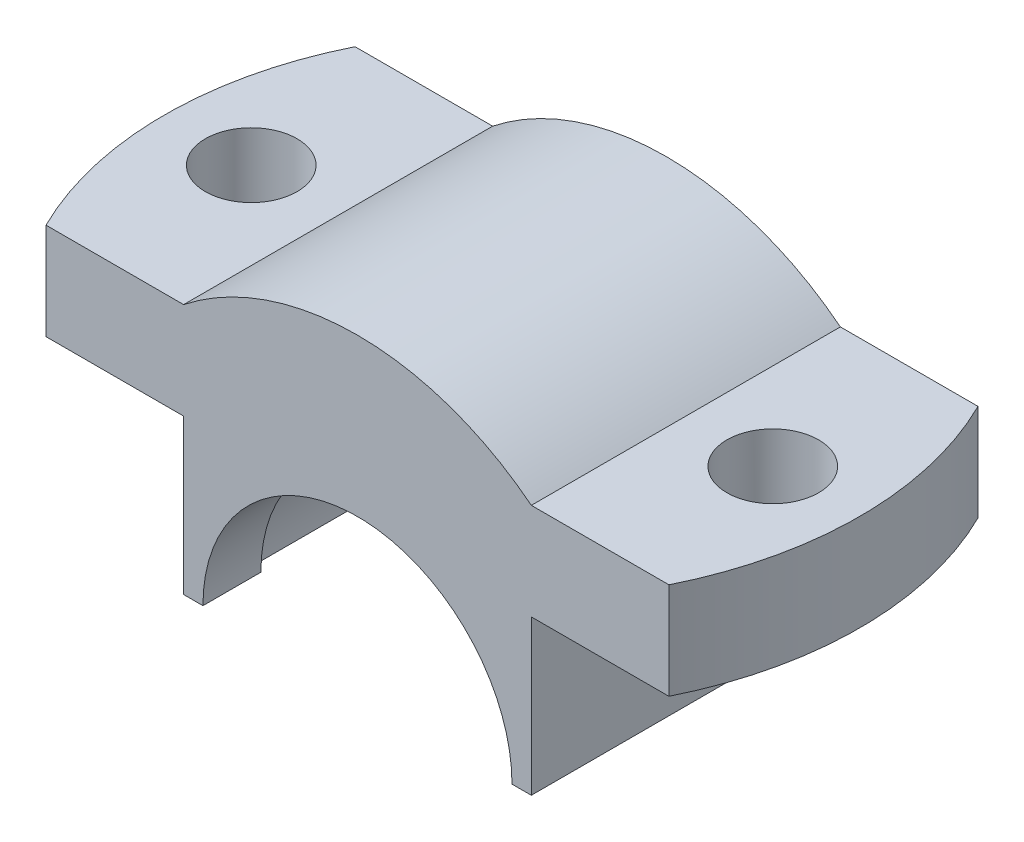
from build123d import *

# Parameters (mm, degrees)
BOSS_EXTRUDE1_DEPTH = 32
SKETCH2_R           = 9.5
CUT_EXTRUDE1_DEPTH  = 64
CUT_EXTRUDE2_DEPTH  = 22
CUT_EXTRUDE3_START  = -50
CUT_EXTRUDE3_DEPTH  = 38
CHAMFER1_SIZE       = 2


with BuildPart() as part:
    # Sketch1 → Boss-Extrude1 (new, symmetric)
    with BuildSketch(Plane.XY):
        with BuildLine():
            Line((-36, 0), (-32, 0))
            ThreePointArc((-32, 0), (0, 32), (32, 0))
            Line((32, 0), (36, 0))
            Line((36, 0), (36, 32))
            Line((36, 32), (72, 32))
            Line((72, 32), (72, 52))
            Line((72, 52), (36, 52))
            ThreePointArc((36, 52), (0, 64.524731996), (-36, 52))
            Line((-36, 52), (-72, 52))
            Line((-72, 52), (-72, 32))
            Line((-72, 32), (-36, 32))
            Line((-36, 32), (-36, 0))
        make_face()
    extrude(amount=BOSS_EXTRUDE1_DEPTH, both=True)

    # Sketch2 → Cut-Extrude1 (cut)
    with BuildSketch(Plane(origin=(0, 52, 0), x_dir=(1, 0, 0), z_dir=(0, 1, 0))):
        with Locations(Location((-54, 0, 0), (0, 0, 270))):
            Circle(SKETCH2_R)
        with Locations(Location((54, 0, 0), (0, 0, 270))):
            Circle(SKETCH2_R)
    extrude(amount=-CUT_EXTRUDE1_DEPTH, mode=Mode.SUBTRACT)

    # Sketch3 → Cut-Extrude2 (cut)
    with BuildSketch(Plane(origin=(0, 52, 0), x_dir=(1, 0, 0), z_dir=(0, 1, 0))):
        with BuildLine():
            ThreePointArc((-72, -4.4e-08), (-70.099431041, 16.433799554), (-64.498061986, 32))
            Line((-64.498061986, 32), (-72, 32))
            Line((-72, 32), (-72, -4.4e-08))
        make_face()
        with BuildLine():
            Line((-72, -32), (-64.498061986, -32))
            ThreePointArc((-64.498061986, -32), (-70.099431031, -16.433799597), (-72, -4.4e-08))
            Line((-72, -4.4e-08), (-72, -32))
        make_face()
        with BuildLine():
            Line((72, 32), (64.498061986, 32))
            ThreePointArc((64.498061986, 32), (70.099431036, 16.433799576), (72, 0))
            Line((72, 0), (72, 32))
        make_face()
        with BuildLine():
            ThreePointArc((72, 0), (70.099431036, -16.433799576), (64.498061986, -32))
            Line((64.498061986, -32), (72, -32))
            Line((72, -32), (72, 0))
        make_face()
    extrude(amount=-CUT_EXTRUDE2_DEPTH, mode=Mode.SUBTRACT)

    # Sketch5 → Cut-Extrude3 (cut)
    with BuildSketch(Plane(origin=(0, 0, -32), x_dir=(-1, 0, 0), z_dir=(0, 0, -1)).offset(CUT_EXTRUDE3_START)):
        with BuildLine():
            Line((-34, 0), (-32, 0))
            ThreePointArc((-32, 0), (0, 32), (32, 0))
            Line((32, 0), (34, 0))
            ThreePointArc((34, 0), (0, 34), (-34, 0))
        make_face()
    extrude(amount=CUT_EXTRUDE3_DEPTH, mode=Mode.SUBTRACT)

    # Chamfer1
    chamfer1_edges = [part.edges().sort_by_distance(p)[0] for p in [
        (0, 32, 18),
        (0, 32, -20),
    ]]
    chamfer(chamfer1_edges, length=CHAMFER1_SIZE - 0.0001)  # a hair under: the kernel refuses the full size


solid = part.part
